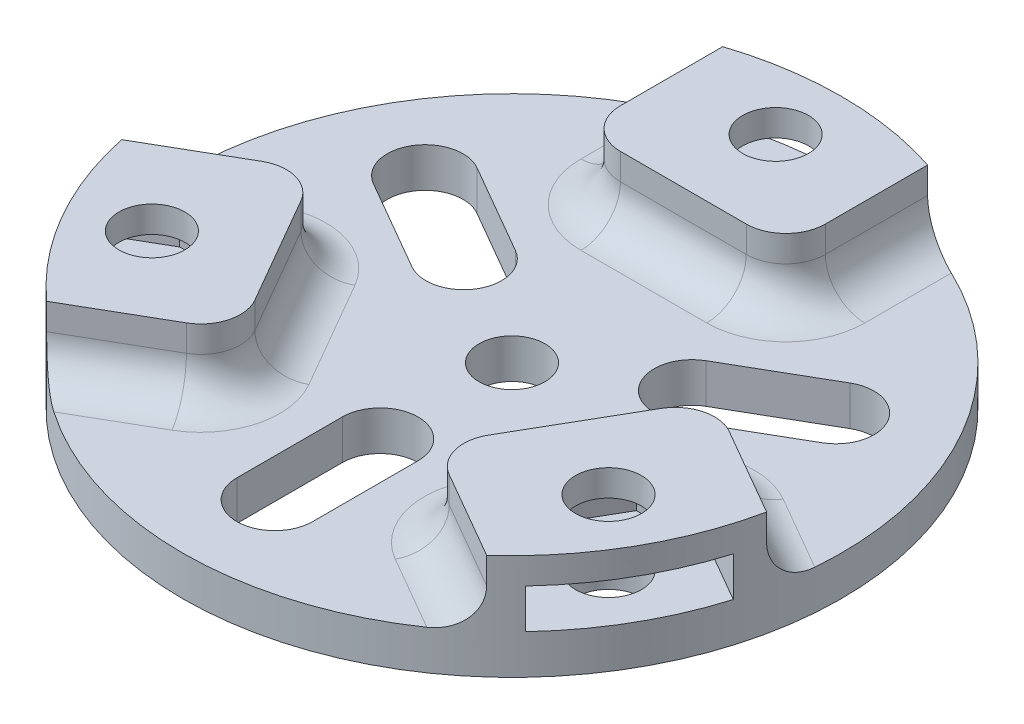
from build123d import *

# Parameters (mm, degrees)
SKETCH1_R           = 25
SKETCH1_R_2         = 2.5
BOSS_EXTRUDE1_DEPTH = 3
BOSS_EXTRUDE2_DEPTH = 3
SKETCH3_R           = 2.5
BOSS_EXTRUDE3_DEPTH = 2
CUT_EXTRUDE1_REACH  = 37.707
FILLET1_R           = 3


with BuildPart() as part:
    # Sketch1 → Boss-Extrude1 (new body)
    with BuildSketch(Plane(origin=(0, 0, 0), x_dir=(1, 0, 0), z_dir=(0, 1, 0))):
        with Locations(Location((0, 0, 0), (0, 0, 270))):
            Circle(SKETCH1_R)
        with Locations(Location((0, 20, 0), (0, 0, 270))):
            Circle(SKETCH1_R_2, mode=Mode.SUBTRACT)
        with Locations(Location((17.320508076, -10, 0), (0, 0, 270))):
            Circle(SKETCH1_R_2, mode=Mode.SUBTRACT)
        with Locations(Location((-17.320508076, -10, 0), (0, 0, 270))):
            Circle(SKETCH1_R_2, mode=Mode.SUBTRACT)
        with Locations(Location((0, 0, 0), (0, 0, 270))):
            Circle(SKETCH1_R_2, mode=Mode.SUBTRACT)
    extrude(amount=BOSS_EXTRUDE1_DEPTH)

    # Sketch2 → Boss-Extrude2 (add)
    with BuildSketch(Plane(origin=(0, 3, 0), x_dir=(1, 0, 0), z_dir=(0, 1, 0))):
        with BuildLine():
            Line((-2.886751346, 15), (-5.773502692, 20))
            Line((-5.773502692, 20), (-5.773502692, 24.324199199))
            ThreePointArc((-5.773502692, 24.324199199), (-6.779359183, 24.063255995), (-7.773502692, 23.760737697))
            Line((-7.773502692, 23.760737697), (-7.773502692, 13))
            Line((-7.773502692, 13), (7.773502692, 13))
            Line((7.773502692, 13), (7.773502692, 23.760737697))
            ThreePointArc((7.773502692, 23.760737697), (6.779359183, 24.063255995), (5.773502692, 24.324199199))
            Line((5.773502692, 24.324199199), (5.773502692, 20))
            Line((5.773502692, 20), (2.886751346, 15))
            Line((2.886751346, 15), (-2.886751346, 15))
        make_face()
        with BuildLine():
            Line((14.43375673, -5), (20.207259422, -5))
            Line((20.207259422, -5), (23.952125779, -7.162099599))
            ThreePointArc((23.952125779, -7.162099599), (24.229070581, -6.160530723), (24.464153804, -5.148318041))
            Line((24.464153804, -5.148318041), (15.145081595, 0.232050808))
            Line((15.145081595, 0.232050808), (7.371578903, -13.232050808))
            Line((7.371578903, -13.232050808), (16.690651112, -18.612419656))
            ThreePointArc((16.690651112, -18.612419656), (17.449711398, -17.902725271), (18.178623087, -17.162099599))
            Line((18.178623087, -17.162099599), (14.43375673, -15))
            Line((14.43375673, -15), (11.547005384, -10))
            Line((11.547005384, -10), (14.43375673, -5))
        make_face()
        with BuildLine():
            Line((-11.547005384, -10), (-14.43375673, -15))
            Line((-14.43375673, -15), (-18.178623087, -17.162099599))
            ThreePointArc((-18.178623087, -17.162099599), (-17.449711398, -17.902725271), (-16.690651112, -18.612419656))
            Line((-16.690651112, -18.612419656), (-7.371578903, -13.232050808))
            Line((-7.371578903, -13.232050808), (-15.145081595, 0.232050808))
            Line((-15.145081595, 0.232050808), (-24.464153804, -5.148318041))
            ThreePointArc((-24.464153804, -5.148318041), (-24.229070581, -6.160530723), (-23.952125779, -7.162099599))
            Line((-23.952125779, -7.162099599), (-20.207259422, -5))
            Line((-20.207259422, -5), (-14.43375673, -5))
            Line((-14.43375673, -5), (-11.547005384, -10))
        make_face()
    extrude(amount=BOSS_EXTRUDE2_DEPTH)

    # Sketch3 → Boss-Extrude3 (add)
    # profile 1 of 3: a face of its own
    with BuildSketch(Plane(origin=(0, 6, 0), x_dir=(1, 0, 0), z_dir=(0, 1, 0))):
        with BuildLine():
            Line((24.464153804, -5.148318041), (15.145081595, 0.232050808))
            Line((15.145081595, 0.232050808), (7.371578903, -13.232050808))
            Line((7.371578903, -13.232050808), (16.690651112, -18.612419656))
            ThreePointArc((16.690651112, -18.612419656), (21.650635095, -12.5), (24.464153804, -5.148318041))
        make_face()
        with Locations(Location((17.320508076, -10, 0), (0, 0, 270))):
            Circle(SKETCH3_R, mode=Mode.SUBTRACT)
    # profile 2 of 3: a face of its own
    with BuildSketch(Plane(origin=(0, 6, 0), x_dir=(1, 0, 0), z_dir=(0, 1, 0))):
        with BuildLine():
            Line((-7.773502692, 23.760737697), (-7.773502692, 13))
            Line((-7.773502692, 13), (7.773502692, 13))
            Line((7.773502692, 13), (7.773502692, 23.760737697))
            ThreePointArc((7.773502692, 23.760737697), (0, 25), (-7.773502692, 23.760737697))
        make_face()
        with Locations(Location((0, 20, 0), (0, 0, 270))):
            Circle(SKETCH3_R, mode=Mode.SUBTRACT)
    # profile 3 of 3: a face of its own
    with BuildSketch(Plane(origin=(0, 6, 0), x_dir=(1, 0, 0), z_dir=(0, 1, 0))):
        with BuildLine():
            Line((-16.690651112, -18.612419656), (-7.371578903, -13.232050808))
            Line((-7.371578903, -13.232050808), (-15.145081595, 0.232050808))
            Line((-15.145081595, 0.232050808), (-24.464153804, -5.148318041))
            ThreePointArc((-24.464153804, -5.148318041), (-21.650635095, -12.5), (-16.690651112, -18.612419656))
        make_face()
        with Locations(Location((-17.320508076, -10, 0), (0, 0, 270))):
            Circle(SKETCH3_R, mode=Mode.SUBTRACT)
    extrude(amount=BOSS_EXTRUDE3_DEPTH)

    # Sketch4 → Cut-Extrude1 (cut, up to next)
    with BuildSketch(Plane(origin=(0, 3, 0), x_dir=(1, 0, 0), z_dir=(0, 1, 0)), mode=Mode.PRIVATE) as cut_extrude1_sk1:
        with BuildLine():
            Line((2.876472216, -10), (2.876472216, -18))
            ThreePointArc((2.876472216, -18), (0, -20.876472216), (-2.876472216, -18))
            Line((-2.876472216, -18), (-2.876472216, -10))
            ThreePointArc((-2.876472216, -10), (0, -7.123527784), (2.876472216, -10))
        make_face()
    cut_extrude1_tool1 = extrude(cut_extrude1_sk1.sketch, amount=-CUT_EXTRUDE1_REACH, mode=Mode.PRIVATE) & part.part
    # Sketch4 → Cut-Extrude1 (cut, up to next)
    with BuildSketch(Plane(origin=(0, 3, 0), x_dir=(1, 0, 0), z_dir=(0, 1, 0)), mode=Mode.PRIVATE) as cut_extrude1_sk2:
        with BuildLine():
            Line((-10.098490146, 2.508901988), (-17.026693376, 6.508901988))
            ThreePointArc((-17.026693376, 6.508901988), (-18.07955528, 10.438236108), (-14.15022116, 11.491098012))
            Line((-14.15022116, 11.491098012), (-7.22201793, 7.491098012))
            ThreePointArc((-7.22201793, 7.491098012), (-6.169156026, 3.561763892), (-10.098490146, 2.508901988))
        make_face()
    cut_extrude1_tool2 = extrude(cut_extrude1_sk2.sketch, amount=-CUT_EXTRUDE1_REACH, mode=Mode.PRIVATE) & part.part
    # Sketch4 → Cut-Extrude1 (cut, up to next)
    with BuildSketch(Plane(origin=(0, 3, 0), x_dir=(1, 0, 0), z_dir=(0, 1, 0)), mode=Mode.PRIVATE) as cut_extrude1_sk3:
        with BuildLine():
            Line((7.22201793, 7.491098012), (14.15022116, 11.491098012))
            ThreePointArc((14.15022116, 11.491098012), (18.07955528, 10.438236108), (17.026693376, 6.508901988))
            Line((17.026693376, 6.508901988), (10.098490146, 2.508901988))
            ThreePointArc((10.098490146, 2.508901988), (6.169156026, 3.561763892), (7.22201793, 7.491098012))
        make_face()
    cut_extrude1_tool3 = extrude(cut_extrude1_sk3.sketch, amount=-CUT_EXTRUDE1_REACH, mode=Mode.PRIVATE) & part.part
    add(cut_extrude1_tool1.solids().sort_by_distance((0, 3, 14))[0], mode=Mode.SUBTRACT)
    add(cut_extrude1_tool2.solids().sort_by_distance((-12.124356, 3, -7))[0], mode=Mode.SUBTRACT)
    add(cut_extrude1_tool3.solids().sort_by_distance((12.124356, 3, -7))[0], mode=Mode.SUBTRACT)

    # Fillet1
    # the kernel refuses this fillet: 3 mm, written as the material it takes off along each edge
    with BuildSketch(Plane(origin=(-7.773502692, 3, -13), x_dir=(0, 0, -1), z_dir=(0, 1, 0)), Plane(origin=(7.773502692, 15.5, -13), x_dir=(0, 0, -1), z_dir=(0, -1, 0)), Plane(origin=(-7.371578903, 3, 13.232050808), x_dir=(-0.8660254037844431, 0, 0.49999999999999195), z_dir=(0, 1, 0)), Plane(origin=(-15.145081595, 3, -0.232050808), x_dir=(0.4999999999999916, 0, 0.8660254037844436), z_dir=(0, 1, 0)), Plane(origin=(15.145081595, 3, -0.232050808), x_dir=(0.8660254037844362, 0, 0.5000000000000043), z_dir=(0, 1, 0)), Plane(origin=(7.371578903, 15.5, 13.232050808), x_dir=(0.8660254037844362, 0, 0.5000000000000042), z_dir=(0, -1, 0))) as fillet1_piece_1:
        with BuildLine():
            CenterArc((FILLET1_R, -FILLET1_R), FILLET1_R, 90, 90)
            Line((0, -FILLET1_R), (0, 0))
            Line((0, 0), (FILLET1_R, 0))
        make_face()
    extrude(amount=12.5, mode=Mode.SUBTRACT)
    # the kernel refuses this fillet: 3 mm, written as the material it adds along each edge
    with BuildSketch(Plane(origin=(-7.773502692, 3, -31.260737697), x_dir=(-1, 0, 0), z_dir=(0, 0, 1))) as fillet1_2_piece_1_section:
        with BuildLine():
            CenterArc((FILLET1_R, -FILLET1_R), FILLET1_R, 90, 90)
            Line((0, -FILLET1_R), (0, 0))
            Line((0, 0), (FILLET1_R, 0))
        make_face()
    fillet1_2_piece_1 = extrude(amount=15.260737697, mode=Mode.PRIVATE)
    fillet1_2_piece_1 = fillet1_2_piece_1 & Plane(origin=(0, 3.679193908, 0), x_dir=(0, 0, 1), z_dir=(0, -1, 0)) * Cylinder(25, 43, mode=Mode.PRIVATE)
    add(fillet1_2_piece_1)
    with BuildSketch(Plane(origin=(7.773502692, 3, -16), x_dir=(1, 0, 0), z_dir=(0, 0, -1))) as fillet1_2_piece_2_section:
        with BuildLine():
            CenterArc((FILLET1_R, -FILLET1_R), FILLET1_R, 90, 90)
            Line((0, -FILLET1_R), (0, 0))
            Line((0, 0), (FILLET1_R, 0))
        make_face()
    fillet1_2_piece_2 = extrude(amount=15.260737697, mode=Mode.PRIVATE)
    fillet1_2_piece_2 = fillet1_2_piece_2 & Plane(origin=(0, 3.67919664, 0), x_dir=(0, 0, 1), z_dir=(0, -1, 0)) * Cylinder(25, 43, mode=Mode.PRIVATE)
    add(fillet1_2_piece_2)
    with BuildSketch(Plane(origin=(-4.773502692, 3, -13), x_dir=(0, 0, 1), z_dir=(1, 0, 0)), Plane(origin=(-8.871578903, 3, 10.633974596), x_dir=(0.8660254037844433, 0, -0.49999999999999195), z_dir=(-0.499999999999992, 0, -0.8660254037844434)), Plane(origin=(13.645081595, 3, 2.366025404), x_dir=(-0.8660254037844363, 0, -0.5000000000000041), z_dir=(-0.5000000000000041, 0, 0.8660254037844363))) as fillet1_2_piece_3:
        with BuildLine():
            CenterArc((FILLET1_R, -FILLET1_R), FILLET1_R, 90, 90)
            Line((0, -FILLET1_R), (0, 0))
            Line((0, 0), (FILLET1_R, 0))
        make_face()
    extrude(amount=9.547005384)
    with BuildSketch(Plane(origin=(-23.185841641, 3, 22.362419656), x_dir=(0.499999999999992, 0, 0.8660254037844433), z_dir=(0.8660254037844433, 0, -0.499999999999992))) as fillet1_2_piece_4_section:
        with BuildLine():
            CenterArc((FILLET1_R, -FILLET1_R), FILLET1_R, 90, 90)
            Line((0, -FILLET1_R), (0, 0))
            Line((0, 0), (FILLET1_R, 0))
        make_face()
    fillet1_2_piece_4 = extrude(amount=15.260737697, mode=Mode.PRIVATE)
    fillet1_2_piece_4 = fillet1_2_piece_4 & Plane(origin=(0, 3.679193908, 0), x_dir=(0, 0, 1), z_dir=(0, -1, 0)) * Cylinder(25, 43, mode=Mode.PRIVATE)
    add(fillet1_2_piece_4)
    with BuildSketch(Plane(origin=(-17.743157806, 3, 1.267949192), x_dir=(-0.49999999999999206, 0, -0.8660254037844433), z_dir=(-0.8660254037844433, 0, 0.49999999999999206))) as fillet1_2_piece_5_section:
        with BuildLine():
            CenterArc((FILLET1_R, -FILLET1_R), FILLET1_R, 90, 90)
            Line((0, -FILLET1_R), (0, 0))
            Line((0, 0), (FILLET1_R, 0))
        make_face()
    fillet1_2_piece_5 = extrude(amount=15.260737697, mode=Mode.PRIVATE)
    fillet1_2_piece_5 = fillet1_2_piece_5 & Plane(origin=(0, 3.67919664, 0), x_dir=(0, 0, 1), z_dir=(0, -1, 0)) * Cylinder(25, 43, mode=Mode.PRIVATE)
    add(fillet1_2_piece_5)
    with BuildSketch(Plane(origin=(30.959344332, 3, 8.898318041), x_dir=(0.5000000000000039, 0, -0.8660254037844364), z_dir=(-0.8660254037844364, 0, -0.5000000000000039))) as fillet1_2_piece_6_section:
        with BuildLine():
            CenterArc((FILLET1_R, -FILLET1_R), FILLET1_R, 90, 90)
            Line((0, -FILLET1_R), (0, 0))
            Line((0, 0), (FILLET1_R, 0))
        make_face()
    fillet1_2_piece_6 = extrude(amount=15.260737697, mode=Mode.PRIVATE)
    fillet1_2_piece_6 = fillet1_2_piece_6 & Plane(origin=(0, 3.679193908, 0), x_dir=(0, 0, 1), z_dir=(0, -1, 0)) * Cylinder(25, 43, mode=Mode.PRIVATE)
    add(fillet1_2_piece_6)
    with BuildSketch(Plane(origin=(9.969655115, 3, 14.732050808), x_dir=(-0.5000000000000041, 0, 0.8660254037844363), z_dir=(0.8660254037844364, 0, 0.5000000000000041))) as fillet1_2_piece_7_section:
        with BuildLine():
            CenterArc((FILLET1_R, -FILLET1_R), FILLET1_R, 90, 90)
            Line((0, -FILLET1_R), (0, 0))
            Line((0, 0), (FILLET1_R, 0))
        make_face()
    fillet1_2_piece_7 = extrude(amount=15.260737697, mode=Mode.PRIVATE)
    fillet1_2_piece_7 = fillet1_2_piece_7 & Plane(origin=(0, 3.67919664, 0), x_dir=(0, 0, 1), z_dir=(0, -1, 0)) * Cylinder(25, 43, mode=Mode.PRIVATE)
    add(fillet1_2_piece_7)
    with BuildSketch(Plane(origin=(16.243157806, 3, 3.866025404), x_dir=(0.5000000000000036, 0, -0.8660254037844366), z_dir=(0.8660254037844366, 0, 0.5000000000000036))) as fillet1_2_piece_8:
        with BuildLine():
            CenterArc((3 + FILLET1_R, FILLET1_R), FILLET1_R, 180, 90)
            Line((3, FILLET1_R), (3, 0))
            Line((3, 0), (3 + FILLET1_R, 0))
        make_face()
    revolve(axis=Axis((16.243157806, 3, 3.866025404), (0, 1, 0)), revolution_arc=90)
    with BuildSketch(Plane(origin=(11.469655115, 3, 12.133974596), x_dir=(-0.5000000000000041, 0, 0.8660254037844363), z_dir=(0.8660254037844363, 0, 0.5000000000000041))) as fillet1_2_piece_9:
        with BuildLine():
            CenterArc((3 + FILLET1_R, -FILLET1_R), FILLET1_R, 90, 90)
            Line((3, -FILLET1_R), (3, 0))
            Line((3, 0), (3 + FILLET1_R, 0))
        make_face()
    revolve(axis=Axis((11.469655115, 3, 12.133974596), (0, -1, 0)), revolution_arc=90)
    with BuildSketch(Plane(origin=(-11.469655115, 3, 12.133974596), x_dir=(0.4999999999999922, 0, 0.8660254037844431), z_dir=(-0.8660254037844431, 0, 0.4999999999999922))) as fillet1_2_piece_10:
        with BuildLine():
            CenterArc((3 + FILLET1_R, FILLET1_R), FILLET1_R, 180, 90)
            Line((3, FILLET1_R), (3, 0))
            Line((3, 0), (3 + FILLET1_R, 0))
        make_face()
    revolve(axis=Axis((-11.469655115, 3, 12.133974596), (0, 1, 0)), revolution_arc=90)
    with BuildSketch(Plane(origin=(-16.243157806, 3, 3.866025404), x_dir=(0.8660254037844433, 0, -0.49999999999999195), z_dir=(0.49999999999999195, 0, 0.8660254037844433))) as fillet1_2_piece_11:
        with BuildLine():
            CenterArc((3 + FILLET1_R, FILLET1_R), FILLET1_R, 180, 90)
            Line((3, FILLET1_R), (3, 0))
            Line((3, 0), (3 + FILLET1_R, 0))
        make_face()
    revolve(axis=Axis((-16.243157806, 3, 3.866025404), (0, 1, 0)), revolution_arc=90)
    with BuildSketch(Plane(origin=(-4.773502692, 3, -16), x_dir=(-1, 0, 0), z_dir=(0, 0, -1))) as fillet1_2_piece_12:
        with BuildLine():
            CenterArc((3 + FILLET1_R, FILLET1_R), FILLET1_R, 180, 90)
            Line((3, FILLET1_R), (3, 0))
            Line((3, 0), (3 + FILLET1_R, 0))
        make_face()
    revolve(axis=Axis((-4.773502692, 3, -16), (0, 1, 0)), revolution_arc=90)
    with BuildSketch(Plane(origin=(4.773502692, 3, -16), x_dir=(1, 0, 0), z_dir=(0, 0, -1))) as fillet1_2_piece_13:
        with BuildLine():
            CenterArc((3 + FILLET1_R, -FILLET1_R), FILLET1_R, 90, 90)
            Line((3, -FILLET1_R), (3, 0))
            Line((3, 0), (3 + FILLET1_R, 0))
        make_face()
    revolve(axis=Axis((4.773502692, 3, -16), (0, -1, 0)), revolution_arc=90)


solid = part.part
